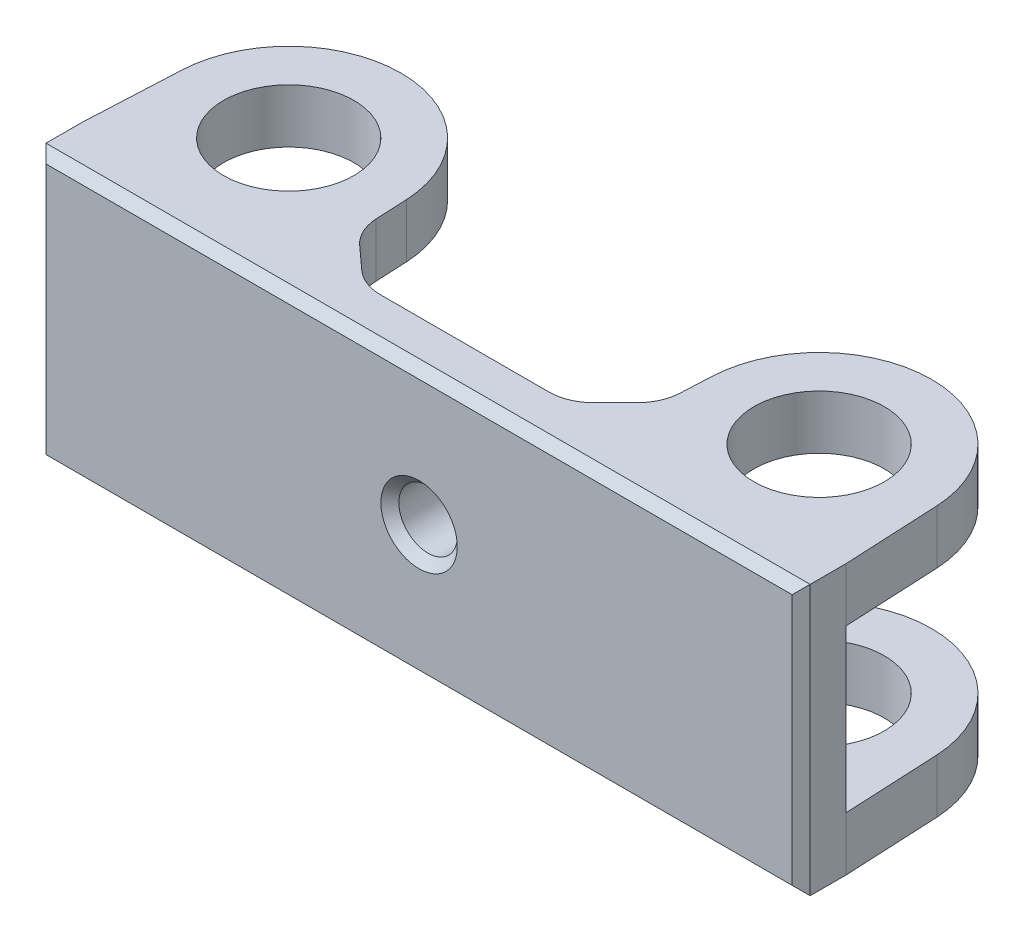
from build123d import *
from OCP.BRepFilletAPI import BRepFilletAPI_MakeChamfer
from build123d.topology import SkipClean

# Parameters (mm, degrees)
SKETCH1_W                 = 85
SKETCH1_H                 = 30
SKETCH1_R                 = 3.25
BOSS_EXTRUDE1_DEPTH       = 5
SKETCH3_R                 = 7.25
BOSS_EXTRUDE2_DEPTH       = 6
CHAMFER2_SIZE             = 5
CHAMFER2_SIZE2            = 5.261204957
FILLET1_R                 = 5
CHAMFER2_OF_MIRROR1_SIZE  = 5
CHAMFER2_OF_MIRROR1_SIZE2 = 5.261204957
FILLET1_OF_MIRROR1_R      = 5
BOSS_EXTRUDE3_START       = 5
SKETCH5_R                 = 6.5
SKETCH5_R_2               = 3.25
BOSS_EXTRUDE3_DEPTH       = 5
CHAMFER1_SIZE             = 5
CHAMFER3_SIZE             = 1


with BuildPart() as part:
    # Sketch1 → Boss-Extrude1 (new body)
    with BuildSketch(Plane.XY):
        Rectangle(SKETCH1_W, SKETCH1_H)
        Circle(SKETCH1_R, mode=Mode.SUBTRACT)
    extrude(amount=BOSS_EXTRUDE1_DEPTH)

    # Sketch3 → Boss-Extrude2 (add)
    # profile 1 of 2: a face of its own
    with BuildSketch(Plane(origin=(0, 15, 0), x_dir=(1, 0, 0), z_dir=(0, 1, 0))):
        with BuildLine():
            Line((42.5, 0), (41.985306827, 10.605898875))
            ThreePointArc((41.985306827, 10.605898875), (29.5, 22.5), (17.014693173, 10.605898875))
            Line((17.014693173, 10.605898875), (16.5, 0))
            Line((16.5, 0), (42.5, 0))
        make_face()
        with Locations(Location((29.5, 10, 0), (0, 0, 270))):
            Circle(SKETCH3_R, mode=Mode.SUBTRACT)
    # profile 2 of 2: a face of its own
    with BuildSketch(Plane(origin=(0, 15, 0), x_dir=(1, 0, 0), z_dir=(0, 1, 0))):
        with BuildLine():
            Line((-42.5, 0), (-41.985306827, 10.605898875))
            ThreePointArc((-41.985306827, 10.605898875), (-29.5, 22.5), (-17.014693173, 10.605898875))
            Line((-17.014693173, 10.605898875), (-16.5, 0))
            Line((-16.5, 0), (-42.5, 0))
        make_face()
        with Locations(Location((-29.5, 10, 0), (0, 0, 270))):
            Circle(SKETCH3_R, mode=Mode.SUBTRACT)
    boss_extrude2 = extrude(amount=-BOSS_EXTRUDE2_DEPTH)

    # Chamfer2: one chamfer whose edges measure the first distance from different faces: ONE call of the kernel's chamfer builder (chamfer() names one face for all edges)
    chamfer2_edges_1 = [part.edges().sort_by_distance(p)[0] for p in [
        (16.5, 12, 0),
    ]]
    chamfer2_side_1 = [part.faces().sort_by_distance(p)[0] for p in [
        (-41.598612181, -3, 0),
    ]]
    chamfer2_edges_2 = [part.edges().sort_by_distance(p)[0] for p in [
        (-16.5, 12, 0),
    ]]
    chamfer2_side_2 = [part.faces().sort_by_distance(p)[0] for p in [
        (-16.757346587, 12, -5.302949437),
    ]]
    chamfer2 = BRepFilletAPI_MakeChamfer(part.part.solid().wrapped)
    for e in chamfer2_edges_1:
        chamfer2.Add(CHAMFER2_SIZE, CHAMFER2_SIZE2, e.wrapped, chamfer2_side_1[0].wrapped)  # the first distance lies on this face
    for e in chamfer2_edges_2:
        chamfer2.Add(CHAMFER2_SIZE, CHAMFER2_SIZE2, e.wrapped, chamfer2_side_2[0].wrapped)  # the first distance lies on this face
    add(Compound.cast(chamfer2.Shape()), mode=Mode.REPLACE)

    # Fillet1
    fillet1_edges = [part.edges().sort_by_distance(p)[0] for p in [
        (11.5, 12, 0),
        (-11.238795043, 12, 0),
        (-16.74235955, 12, -4.994122731),
        (16.755020653, 12, -5.255020653),
    ]]
    fillet(fillet1_edges, radius=FILLET1_R)

    # Mirror1: Boss-Extrude2 across plane
    add(boss_extrude2.mirror(Plane.ZX))

    # Chamfer2 of Mirror1: one chamfer whose edges measure the first distance from different faces: ONE call of the kernel's chamfer builder (chamfer() names one face for all edges)
    chamfer2_of_mirror1_edges_1 = [part.edges().sort_by_distance(p)[0] for p in [
        (16.5, -12, 0),
    ]]
    chamfer2_of_mirror1_side_1 = [part.faces().sort_by_distance(p)[0] for p in [
        (-41.598612181, 3, 0),
    ]]
    chamfer2_of_mirror1_edges_2 = [part.edges().sort_by_distance(p)[0] for p in [
        (-16.5, -12, 0),
    ]]
    chamfer2_of_mirror1_side_2 = [part.faces().sort_by_distance(p)[0] for p in [
        (-16.757346587, -12, -5.302949437),
    ]]
    chamfer2_of_mirror1 = BRepFilletAPI_MakeChamfer(part.part.solid().wrapped)
    for e in chamfer2_of_mirror1_edges_1:
        chamfer2_of_mirror1.Add(CHAMFER2_OF_MIRROR1_SIZE, CHAMFER2_OF_MIRROR1_SIZE2, e.wrapped, chamfer2_of_mirror1_side_1[0].wrapped)  # the first distance lies on this face
    for e in chamfer2_of_mirror1_edges_2:
        chamfer2_of_mirror1.Add(CHAMFER2_OF_MIRROR1_SIZE, CHAMFER2_OF_MIRROR1_SIZE2, e.wrapped, chamfer2_of_mirror1_side_2[0].wrapped)  # the first distance lies on this face
    add(Compound.cast(chamfer2_of_mirror1.Shape()), mode=Mode.REPLACE)

    # Fillet1 of Mirror1
    fillet1_of_mirror1_edges = [part.edges().sort_by_distance(p)[0] for p in [
        (11.5, -12, 0),
        (-11.238795043, -12, 0),
        (-16.74235955, -12, -4.994122731),
        (16.755020653, -12, -5.255020653),
    ]]
    fillet(fillet1_of_mirror1_edges, radius=FILLET1_OF_MIRROR1_R)

    # Sketch5 → Boss-Extrude3 (add)
    with SkipClean():  # the faces are left unmerged after this step: merging them gives an invalid solid
        with BuildSketch(Plane(origin=(0, 0, 0), x_dir=(-1, 0, 0), z_dir=(0, 0, -1)).offset(BOSS_EXTRUDE3_START)):
            Circle(SKETCH5_R)
            Circle(SKETCH5_R_2, mode=Mode.SUBTRACT)
        extrude(amount=-BOSS_EXTRUDE3_DEPTH)

    # Chamfer1
    chamfer1_edges = [part.edges().sort_by_distance(p)[0] for p in [
        (6.5, 0, 0),
    ]]
    chamfer(chamfer1_edges, length=CHAMFER1_SIZE - 0.0001)  # a hair under: the kernel refuses the full size

    # Chamfer3
    chamfer3_edges = [part.edges().sort_by_distance(p)[0] for p in [
        (-42.5, 0, 5),
        (-3.25, 0, 5),
        (0, -15, 5),
        (42.5, 0, 5),
        (0, 15, 5),
    ]]
    chamfer(chamfer3_edges, length=CHAMFER3_SIZE)


solid = part.part
